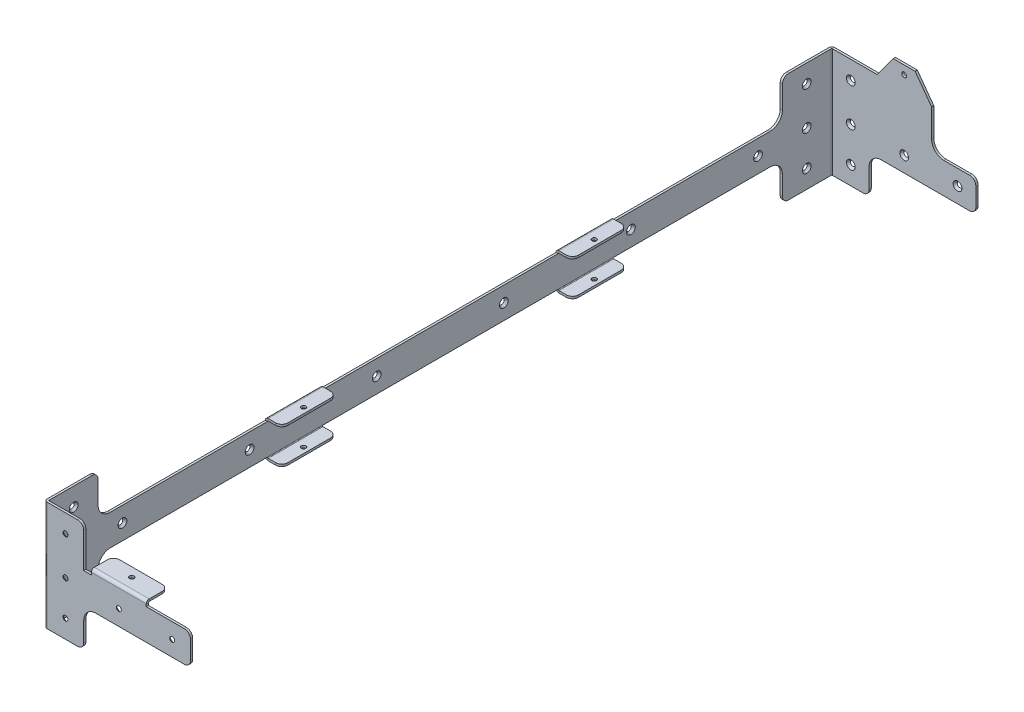
from build123d import *

# Parameters (mm, degrees)
SKETCH1_W                                         = 815.975
SKETCH1_H                                         = 33.147
BASE_FLANGE1_DEPTH                                = 2.286
EDGE_FLANGE2_STRIP_W                              = 10.8712
EDGE_FLANGE2_STRIP_H                              = 2.286
EDGE_FLANGE2_STRIP_CUT_DEPTH                      = 815.975
EDGE_FLANGE2_DEPTH                                = 815.975
EDGE_FLANGE3_STRIP_W                              = 10.8712
EDGE_FLANGE3_STRIP_H                              = 2.286
EDGE_FLANGE3_STRIP_CUT_DEPTH                      = 815.975
EDGE_FLANGE3_DEPTH                                = 815.975
EDGE_FLANGE4_STRIP_W                              = 10.8712
EDGE_FLANGE4_STRIP_H                              = 2.286
EDGE_FLANGE4_STRIP_CUT_DEPTH                      = 32.1818
EDGE_FLANGE4_DEPTH                                = 32.1818
EDGE_FLANGE6_STRIP_W                              = 10.8712
EDGE_FLANGE6_STRIP_H                              = 2.286
EDGE_FLANGE6_STRIP_CUT_DEPTH                      = 32.1818
EDGE_FLANGE6_DEPTH                                = 32.1818
CUT_EXTRUDE1_START                                = -3.0226
SKETCH18_W                                        = 17.145
SKETCH18_H                                        = 227.9015
SKETCH18_H_2                                      = 245.872
CUT_EXTRUDE1_DEPTH                                = 3.0226
CUT_EXTRUDE2_START                                = -3.0226
SKETCH23_W                                        = 17.145
SKETCH23_H                                        = 227.9015
SKETCH23_H_2                                      = 245.872
CUT_EXTRUDE2_DEPTH                                = 3.0226
EDGE_FLANGE7_DEPTH                                = 149.3774
CUT_EXTRUDE4_START                                = -5.4991
SKETCH46_W                                        = 46.1137
SKETCH46_H                                        = 23.01875
CUT_EXTRUDE4_DEPTH                                = 5.4991
SKETCH24_R                                        = 2.38125
CUT_EXTRUDE3_DEPTH                                = 834.161324794
FILLET1_R                                         = 6.35
BOSS_EXTRUDE1_DEPTH                               = 2.286
F_10_CLEARANCE_HOLE1_D                            = 4.9784
CSK_FOR_8_FLAT_HEAD_SOCKET_CAP_SCREW2_A_COUNT     = 2
CSK_FOR_8_FLAT_HEAD_SOCKET_CAP_SCREW2_A_PITCH     = 55.6387
CSK_FOR_8_FLAT_HEAD_SOCKET_CAP_SCRE_2_COUNT       = 2
CSK_FOR_8_FLAT_HEAD_SOCKET_CAP_SCRE_2_PITCH       = 111.2774
CSK_FOR_8_FLAT_HEAD_SOCKET_CAP_SCREW1_D           = 4.3053
CSK_FOR_8_FLAT_HEAD_SOCKET_CAP_SCREW1_DEPTH       = 76.2
CSK_FOR_8_FLAT_HEAD_SOCKET_CAP_SCREW1_CSINK_D     = 9.1186
CSK_FOR_8_FLAT_HEAD_SOCKET_CAP_SCREW1_CSINK_ANGLE = 82
CSK_FOR_8_FLAT_HEAD_SOCKET_CAP_SCREW1_TIP         = 1.293442612
BOSS_EXTRUDE2_DEPTH                               = 42.7101
BOSS_EXTRUDE3_START                               = 39.4081
BOSS_EXTRUDE3_DEPTH                               = 39.4081
CSK_FOR_8_FLAT_HEAD_SOCKET_CAP_SCREW3_A_COUNT     = 2
CSK_FOR_8_FLAT_HEAD_SOCKET_CAP_SCREW3_A_PITCH     = 76.2
CSK_FOR_8_FLAT_HEAD_SOCKET_CAP_SCREW4_A_COUNT     = 2
CSK_FOR_8_FLAT_HEAD_SOCKET_CAP_SCREW4_A_PITCH     = 39.751
CSK_FOR_8_FLAT_HEAD_SOCKET_CAP_SCRE_3_COUNT       = 2
CSK_FOR_8_FLAT_HEAD_SOCKET_CAP_SCRE_3_PITCH       = 76.2
BOSS_EXTRUDE6_START                               = -2.286
BOSS_EXTRUDE6_DEPTH                               = 2.286
FILLET2_R                                         = 6.35
FILLET3_R                                         = 12.7


# Read off the part's stored shape, not the designer's step: Boss-Extrude6
# Sheet-metal steps are written as plain solids
with BuildPart() as part:
    # Sketch1 → Base-Flange1 (new body)
    with BuildSketch(Plane(origin=(0, 0, 0), x_dir=(0, 0, -1), z_dir=(1, 0, 0))):
        with Locations((407.9875, 16.5735)):
            Rectangle(SKETCH1_W, SKETCH1_H)
    extrude(amount=-BASE_FLANGE1_DEPTH)

    # Edge-Flange2 strip (across the edge) → Edge-Flange2 strip cut (cut)
    with BuildSketch(Plane(origin=(0, 33.401, -815.975), x_dir=(0, -1, 0), z_dir=(0, 0, 1))):
        with Locations((-4.699, -1.143)):
            Rectangle(EDGE_FLANGE2_STRIP_W, EDGE_FLANGE2_STRIP_H)
    extrude(amount=EDGE_FLANGE2_STRIP_CUT_DEPTH, mode=Mode.SUBTRACT)

    # Edge-Flange2 section (across the edge) → Edge-Flange2 (add)
    with BuildSketch(Plane(origin=(0, 33.401, -815.975), x_dir=(0, -1, 0), z_dir=(0, 0, 1))):
        with BuildLine():
            Line((-2.286, 0.7366), (-2.286, 14.859))
            Line((-2.286, 14.859), (0, 14.859))
            Line((0, 14.859), (0, 0.7366))
            ThreePointArc((0, 0.7366), (0.215745145, 0.215745145), (0.7366, 0))
            Line((0.7366, 0), (0.7366, -2.286))
            ThreePointArc((0.7366, -2.286), (-1.400700957, -1.400700957), (-2.286, 0.7366))
        make_face()
    extrude(amount=EDGE_FLANGE2_DEPTH)

    # Edge-Flange3 strip (across the edge) → Edge-Flange3 strip cut (cut)
    with BuildSketch(Plane(origin=(0, -0.254, 0), x_dir=(0, 1, 0), z_dir=(0, 0, -1))):
        with Locations((-4.699, -1.143)):
            Rectangle(EDGE_FLANGE3_STRIP_W, EDGE_FLANGE3_STRIP_H)
    extrude(amount=EDGE_FLANGE3_STRIP_CUT_DEPTH, mode=Mode.SUBTRACT)

    # Edge-Flange3 section (across the edge) → Edge-Flange3 (add)
    with BuildSketch(Plane(origin=(0, -0.254, 0), x_dir=(0, 1, 0), z_dir=(0, 0, -1))):
        with BuildLine():
            Line((-2.286, 0.7366), (-2.286, 14.859))
            Line((-2.286, 14.859), (0, 14.859))
            Line((0, 14.859), (0, 0.7366))
            ThreePointArc((0, 0.7366), (0.215745145, 0.215745145), (0.7366, 0))
            Line((0.7366, 0), (0.7366, -2.286))
            ThreePointArc((0.7366, -2.286), (-1.400700957, -1.400700957), (-2.286, 0.7366))
        make_face()
    extrude(amount=EDGE_FLANGE3_DEPTH)

    # Edge-Flange4 strip (across the edge) → Edge-Flange4 strip cut (cut)
    with BuildSketch(Plane(origin=(0, 32.6644, 0.254), x_dir=(0, 0, -1), z_dir=(0, -1, 0))):
        with Locations((-4.699, -1.143)):
            Rectangle(EDGE_FLANGE4_STRIP_W, EDGE_FLANGE4_STRIP_H)
    extrude(amount=EDGE_FLANGE4_STRIP_CUT_DEPTH, mode=Mode.SUBTRACT)

    # Edge-Flange4 section (across the edge) → Edge-Flange4 (add)
    with BuildSketch(Plane(origin=(0, 32.6644, 0.254), x_dir=(0, 0, -1), z_dir=(0, -1, 0))):
        with BuildLine():
            Line((-2.286, 0.7366), (-2.286, 150.114))
            Line((-2.286, 150.114), (0, 150.114))
            Line((0, 150.114), (0, 0.7366))
            ThreePointArc((0, 0.7366), (0.215745145, 0.215745145), (0.7366, 0))
            Line((0.7366, 0), (0.7366, -2.286))
            ThreePointArc((0.7366, -2.286), (-1.400700957, -1.400700957), (-2.286, 0.7366))
        make_face()
    extrude(amount=EDGE_FLANGE4_DEPTH)

    # Edge-Flange6 strip (across the edge) → Edge-Flange6 strip cut (cut)
    with BuildSketch(Plane(origin=(0, 0.4826, -816.229), x_dir=(0, 0, 1), z_dir=(0, 1, 0))):
        with Locations((-4.699, -1.143)):
            Rectangle(EDGE_FLANGE6_STRIP_W, EDGE_FLANGE6_STRIP_H)
    extrude(amount=EDGE_FLANGE6_STRIP_CUT_DEPTH, mode=Mode.SUBTRACT)

    # Edge-Flange6 section (across the edge) → Edge-Flange6 (add)
    with BuildSketch(Plane(origin=(0, 0.4826, -816.229), x_dir=(0, 0, 1), z_dir=(0, 1, 0))):
        with BuildLine():
            Line((-2.286, 0.7366), (-2.286, 150.114))
            Line((-2.286, 150.114), (0, 150.114))
            Line((0, 150.114), (0, 0.7366))
            ThreePointArc((0, 0.7366), (0.215745145, 0.215745145), (0.7366, 0))
            Line((0.7366, 0), (0.7366, -2.286))
            ThreePointArc((0.7366, -2.286), (-1.400700957, -1.400700957), (-2.286, 0.7366))
        make_face()
    extrude(amount=EDGE_FLANGE6_DEPTH)

    # Sketch18 → Cut-Extrude1 (cut)
    with BuildSketch(Plane(origin=(0, 35.687, 0), x_dir=(1, 0, 0), z_dir=(0, 1, 0)).offset(CUT_EXTRUDE1_START)):
        with Locations((6.2865, 702.02425)):
            Rectangle(SKETCH18_W, SKETCH18_H)
        with Locations((6.2865, 407.9875)):
            Rectangle(SKETCH18_W, SKETCH18_H_2)
        with Locations((6.2865, 113.95075)):
            Rectangle(SKETCH18_W, SKETCH18_H)
    extrude(amount=CUT_EXTRUDE1_DEPTH, mode=Mode.SUBTRACT)

    # Sketch23 → Cut-Extrude2 (cut)
    with BuildSketch(Plane.XZ.offset(2.54).offset(CUT_EXTRUDE2_START)):
        with Locations((6.2865, -113.95075)):
            Rectangle(SKETCH23_W, SKETCH23_H)
        with Locations((6.2865, -702.02425)):
            Rectangle(SKETCH23_W, SKETCH23_H)
        with Locations((6.2865, -407.9875)):
            Rectangle(SKETCH23_W, SKETCH23_H_2)
    extrude(amount=CUT_EXTRUDE2_DEPTH, mode=Mode.SUBTRACT)

    # Edge-Flange7 section (across the edge) → Edge-Flange7 (add)
    with BuildSketch(Plane(origin=(0.7366, 35.8775, 0.254), x_dir=(0, -1, 0), z_dir=(1, 0, 0))):
        with BuildLine():
            Line((-2.286, 0.7366), (-2.286, 20.73275))
            Line((-2.286, 20.73275), (0, 20.73275))
            Line((0, 20.73275), (0, 0.7366))
            ThreePointArc((0, 0.7366), (0.215745145, 0.215745145), (0.7366, 0))
            Line((0.7366, 0), (3.2131, 0))
            Line((3.2131, 0), (3.2131, -2.286))
            Line((3.2131, -2.286), (0.7366, -2.286))
            ThreePointArc((0.7366, -2.286), (-1.400700957, -1.400700957), (-2.286, 0.7366))
        make_face()
    extrude(amount=EDGE_FLANGE7_DEPTH)

    # Sketch46 → Cut-Extrude4 (cut)
    with BuildSketch(Plane(origin=(0, 38.1635, 0), x_dir=(1, 0, 0), z_dir=(0, 1, 0)).offset(CUT_EXTRUDE4_START)):
        with Locations((127.05715, 8.969375)):
            Rectangle(SKETCH46_W, SKETCH46_H)
        with Locations((23.79345, 8.969375)):
            Rectangle(SKETCH46_W, SKETCH46_H)
    extrude(amount=CUT_EXTRUDE4_DEPTH, mode=Mode.SUBTRACT)

    # Sketch24 → Cut-Extrude3 (cut, through all)
    with BuildSketch(Plane(origin=(0, 38.1635, 0), x_dir=(1, 0, 0), z_dir=(0, 1, 0))):
        with Locations((9.032875, 256.4765)):
            Circle(SKETCH24_R)
        with Locations((9.032875, 559.4985)):
            Circle(SKETCH24_R)
        with Locations(Location((75.4253, 10.95375, 0), (0, 0, 270))):
            Circle(SKETCH24_R)
    extrude(amount=-CUT_EXTRUDE3_DEPTH, mode=Mode.SUBTRACT)

    # Fillet1
    fillet1_edges = [part.edges().sort_by_distance(p)[0] for p in [
        (150.114, 0.4826, 1.397),
        (150.114, 0.4826, -817.372),
        (150.114, 32.6644, -817.372),
        (14.859, 34.544, -588.0735),
        (14.859, 34.544, -530.9235),
        (14.859, 34.544, -285.0515),
        (14.859, 34.544, -227.9015),
        (14.859, -1.397, -588.0735),
        (14.859, -1.397, -285.0515),
        (14.859, -1.397, -530.9235),
        (14.859, -1.397, -227.9015),
        (104.0003, 37.0205, -20.47875),
        (150.114, 32.6644, 1.397),
        (46.8503, 37.0205, -20.47875),
    ]]
    fillet(fillet1_edges, radius=FILLET1_R)

    # Sketch55 → Boss-Extrude1 (add)
    with BuildSketch(Plane(origin=(0, 0, -818.515), x_dir=(-1, 0, 0), z_dir=(0, 0, -1))):
        Polygon((-104.0003, 32.6644), (-46.8503, 32.6644), (-46.8503, 74.6379), (-63.9953, 98.1329), (-86.8553, 98.1329), (-104.0003, 74.6379), align=None)
    extrude(amount=-BOSS_EXTRUDE1_DEPTH)

    # #10 Clearance Hole1 (through all)
    with Locations(Plane(origin=(0, 0, -818.515), x_dir=(-1, 0, 0), z_dir=(0, 0, -1))):
        with Locations((-75.4253, 89.2429)):
            Hole(F_10_CLEARANCE_HOLE1_D / 2)

    # Sketch60 → CSK for #8 Flat Head Socket Cap Screw2 (revolve, cut)
    with BuildSketch(Plane(origin=(131.064, 16.5735, 0.254), x_dir=(0, 1, 0), z_dir=(1, 0, 0))):
        Polygon((0, 0), (0, 77.493442612), (2.15265, 76.2), (2.15265, 2.768534127), (4.5593, 0), align=None)
    csk_for_8_flat_head_socket_cap_screw2 = revolve(axis=Axis((131.064, 16.5735, -6.096), (0, 0, 1)), mode=Mode.SUBTRACT)

    # CSK for #8 Flat Head Socket Cap Screw2 a: CSK for #8 Flat Head Socket Cap Screw2 ×2
    with Locations(*[(-i * CSK_FOR_8_FLAT_HEAD_SOCKET_CAP_SCREW2_A_PITCH, 0, 0) for i in range(1, CSK_FOR_8_FLAT_HEAD_SOCKET_CAP_SCREW2_A_COUNT)]):
        add(csk_for_8_flat_head_socket_cap_screw2, mode=Mode.SUBTRACT)

    # CSK for _8 Flat Head Socket Cap Scre 2: CSK for #8 Flat Head Socket Cap Screw2 ×2
    with Locations(*[(-i * CSK_FOR_8_FLAT_HEAD_SOCKET_CAP_SCRE_2_PITCH, 0, 0) for i in range(1, CSK_FOR_8_FLAT_HEAD_SOCKET_CAP_SCRE_2_COUNT)]):
        add(csk_for_8_flat_head_socket_cap_screw2, mode=Mode.SUBTRACT)

    # CSK for #8 Flat Head Socket Cap Screw1
    with Locations(Plane(origin=(0, 0, 0), x_dir=(0, 0, -1), z_dir=(1, 0, 0))):
        with Locations((76.6826, 16.5735), (209.20456, 16.5735), (341.72652, 16.5735), (474.24848, 16.5735), (606.77044, 16.5735), (739.2924, 16.5735)):
            CounterSinkHole(CSK_FOR_8_FLAT_HEAD_SOCKET_CAP_SCREW1_D / 2, CSK_FOR_8_FLAT_HEAD_SOCKET_CAP_SCREW1_CSINK_D / 2, depth=CSK_FOR_8_FLAT_HEAD_SOCKET_CAP_SCREW1_DEPTH, counter_sink_angle=CSK_FOR_8_FLAT_HEAD_SOCKET_CAP_SCREW1_CSINK_ANGLE)
            with Locations((0, 0, -(CSK_FOR_8_FLAT_HEAD_SOCKET_CAP_SCREW1_DEPTH + CSK_FOR_8_FLAT_HEAD_SOCKET_CAP_SCREW1_TIP / 2))):  # 118° drill point
                Cone(0, CSK_FOR_8_FLAT_HEAD_SOCKET_CAP_SCREW1_D / 2, CSK_FOR_8_FLAT_HEAD_SOCKET_CAP_SCREW1_TIP, mode=Mode.SUBTRACT)

    # Mirror1: CSK for #8 Flat Head Socket Cap Screw2 across plane
    add(csk_for_8_flat_head_socket_cap_screw2.mirror(Plane(origin=(0, 0, -407.9875), x_dir=(1, 0, 0), z_dir=(0, 0, -1))), mode=Mode.SUBTRACT)

    # Mirror1 copy 1 sketch → Mirror1 copy 1 (revolve, cut)
    with BuildSketch(Plane(origin=(75.4253, 16.5735, -816.229), x_dir=(0, 1, 0), z_dir=(1, 0, 0))):
        Polygon((0, 0), (0, -77.493442612), (2.15265, -76.2), (2.15265, -2.768534127), (4.5593, 0), align=None)
    revolve(axis=Axis((75.4253, 16.5735, -809.879), (0, 0, 1)), mode=Mode.SUBTRACT)

    # Mirror1 copy 2 sketch → Mirror1 copy 2 (revolve, cut)
    with BuildSketch(Plane(origin=(19.7866, 16.5735, -816.229), x_dir=(0, 1, 0), z_dir=(1, 0, 0))):
        Polygon((0, 0), (0, -77.493442612), (2.15265, -76.2), (2.15265, -2.768534127), (4.5593, 0), align=None)
    revolve(axis=Axis((19.7866, 16.5735, -809.879), (0, 0, 1)), mode=Mode.SUBTRACT)

    # Sketch63 → Boss-Extrude2 (add)
    with BuildSketch(Plane(origin=(0, 32.6644, 0), x_dir=(1, 0, 0), z_dir=(0, 1, 0))):
        with BuildLine():
            Line((38.8366, 818.515), (38.8366, 816.229))
            Line((38.8366, 816.229), (0.7366, 816.229))
            ThreePointArc((0.7366, 816.229), (0.215745145, 816.013254855), (0, 815.4924))
            Line((0, 815.4924), (0, 764.6924))
            Line((0, 764.6924), (-2.286, 764.6924))
            Line((-2.286, 764.6924), (-2.286, 815.4924))
            ThreePointArc((-2.286, 815.4924), (-1.400700957, 817.629700957), (0.7366, 818.515))
            Line((0.7366, 818.515), (38.8366, 818.515))
        make_face()
    boss_extrude2 = extrude(amount=BOSS_EXTRUDE2_DEPTH)

    # Sketch64 → Boss-Extrude3 (add)
    with BuildSketch(Plane.XZ.offset(-0.4826).offset(BOSS_EXTRUDE3_START)):
        with BuildLine():
            Line((38.8366, -818.515), (38.8366, -816.229))
            Line((38.8366, -816.229), (0.7366, -816.229))
            ThreePointArc((0.7366, -816.229), (0.215745145, -816.013254855), (0, -815.4924))
            Line((0, -815.4924), (0, -764.6924))
            Line((0, -764.6924), (-2.286, -764.6924))
            Line((-2.286, -764.6924), (-2.286, -815.4924))
            ThreePointArc((-2.286, -815.4924), (-1.400700957, -817.629700957), (0.7366, -818.515))
            Line((0.7366, -818.515), (38.8366, -818.515))
        make_face()
    boss_extrude3 = extrude(amount=-BOSS_EXTRUDE3_DEPTH)

    # Sketch66 → CSK for #8 Flat Head Socket Cap Screw3 (revolve, cut)
    with BuildSketch(Plane(origin=(19.7866, 56.3245, -816.229), x_dir=(0, -1, 0), z_dir=(1, 0, 0))):
        Polygon((0, 0), (0, 77.493442612), (2.15265, 76.2), (2.15265, 2.768534127), (4.5593, 0), align=None)
    csk_for_8_flat_head_socket_cap_screw3 = revolve(axis=Axis((19.7866, 56.3245, -809.879), (0, 0, -1)), mode=Mode.SUBTRACT)

    # CSK for #8 Flat Head Socket Cap Screw3 a: CSK for #8 Flat Head Socket Cap Screw3 ×2
    with Locations(*[(0, -i * CSK_FOR_8_FLAT_HEAD_SOCKET_CAP_SCREW3_A_PITCH, 0) for i in range(1, CSK_FOR_8_FLAT_HEAD_SOCKET_CAP_SCREW3_A_COUNT)]):
        add(csk_for_8_flat_head_socket_cap_screw3, mode=Mode.SUBTRACT)

    # Sketch68 → CSK for #8 Flat Head Socket Cap Screw4 (revolve, cut)
    with BuildSketch(Plane(origin=(0, 56.3245, -790.0924), x_dir=(0, 0, -1), z_dir=(0, 1, 0))):
        Polygon((0, 0), (0, 77.493442612), (2.15265, 76.2), (2.15265, 2.768534127), (4.5593, 0), align=None)
    csk_for_8_flat_head_socket_cap_screw4 = revolve(axis=Axis((6.35, 56.3245, -790.0924), (-1, 0, 0)), mode=Mode.SUBTRACT)

    # CSK for #8 Flat Head Socket Cap Screw4 a: CSK for #8 Flat Head Socket Cap Screw4 ×2
    with Locations(*[(0, -i * CSK_FOR_8_FLAT_HEAD_SOCKET_CAP_SCREW4_A_PITCH, 0) for i in range(1, CSK_FOR_8_FLAT_HEAD_SOCKET_CAP_SCREW4_A_COUNT)]):
        add(csk_for_8_flat_head_socket_cap_screw4, mode=Mode.SUBTRACT)

    # CSK for _8 Flat Head Socket Cap Scre 3: CSK for #8 Flat Head Socket Cap Screw4 ×2
    with Locations(*[(0, -i * CSK_FOR_8_FLAT_HEAD_SOCKET_CAP_SCRE_3_PITCH, 0) for i in range(1, CSK_FOR_8_FLAT_HEAD_SOCKET_CAP_SCRE_3_COUNT)]):
        add(csk_for_8_flat_head_socket_cap_screw4, mode=Mode.SUBTRACT)

    # Mirror2: Boss-Extrude2, Boss-Extrude3, CSK for #8 Flat Head Socket Cap Screw3, CSK for #8 Flat Head Socket Cap Screw4 across plane
    add(boss_extrude2.mirror(Plane(origin=(0, 0, -407.9875), x_dir=(1, 0, 0), z_dir=(0, 0, -1))))
    add(boss_extrude3.mirror(Plane(origin=(0, 0, -407.9875), x_dir=(1, 0, 0), z_dir=(0, 0, -1))))
    add(csk_for_8_flat_head_socket_cap_screw3.mirror(Plane(origin=(0, 0, -407.9875), x_dir=(1, 0, 0), z_dir=(0, 0, -1))), mode=Mode.SUBTRACT)
    add(csk_for_8_flat_head_socket_cap_screw4.mirror(Plane(origin=(0, 0, -407.9875), x_dir=(1, 0, 0), z_dir=(0, 0, -1))), mode=Mode.SUBTRACT)

    # Mirror2 copy 1 sketch → Mirror2 copy 1 (revolve, cut)
    with BuildSketch(Plane(origin=(19.7866, -19.8755, 0.254), x_dir=(0, -1, 0), z_dir=(1, 0, 0))):
        Polygon((0, 0), (0, -77.493442612), (2.15265, -76.2), (2.15265, -2.768534127), (4.5593, 0), align=None)
    revolve(axis=Axis((19.7866, -19.8755, -6.096), (0, 0, -1)), mode=Mode.SUBTRACT)

    # Mirror2 copy 2 sketch → Mirror2 copy 2 (revolve, cut)
    with BuildSketch(Plane(origin=(0, 16.5735, -25.8826), x_dir=(0, 0, 1), z_dir=(0, 1, 0))):
        Polygon((0, 0), (0, -77.493442612), (2.15265, -76.2), (2.15265, -2.768534127), (4.5593, 0), align=None)
    revolve(axis=Axis((6.35, 16.5735, -25.8826), (1, 0, 0)), mode=Mode.SUBTRACT)

    # Mirror2 copy 3 sketch → Mirror2 copy 3 (revolve, cut)
    with BuildSketch(Plane(origin=(0, -19.8755, -25.8826), x_dir=(0, 0, 1), z_dir=(0, 1, 0))):
        Polygon((0, 0), (0, -77.493442612), (2.15265, -76.2), (2.15265, -2.768534127), (4.5593, 0), align=None)
    revolve(axis=Axis((6.35, -19.8755, -25.8826), (1, 0, 0)), mode=Mode.SUBTRACT)

    # Boss-Extrude6 outline → Boss-Extrude6 (add)
    with BuildSketch(Plane(origin=(0, 0, -818.515), x_dir=(-1, 0, 0), z_dir=(0, 0, -1)).offset(BOSS_EXTRUDE6_START)):
        Polygon((-38.8366, 32.6644), (-38.8366, 75.3745), (-47.387818919, 75.3745), (-46.8503, 74.6379), (-46.8503, 32.6644), align=None)
    extrude(amount=BOSS_EXTRUDE6_DEPTH)

    # Fillet2
    fillet2_edges = [part.edges().sort_by_distance(p)[0] for p in [
        (-1.143, 75.3745, -764.6924),
        (38.8366, -38.9255, -817.372),
        (-1.143, -38.9255, -764.6924),
        (38.8366, 75.3745, 1.397),
        (-1.143, 75.3745, -51.2826),
        (-1.143, -38.9255, -51.2826),
        (38.8366, -38.9255, 1.397),
    ]]
    fillet(fillet2_edges, radius=FILLET2_R)

    # Fillet3
    fillet3_edges = [part.edges().sort_by_distance(p)[0] for p in [
        (104.0003, 32.6644, -817.372),
        (-1.143, 32.6644, -764.6924),
        (38.8366, 0.4826, -817.372),
        (-1.143, 0.4826, -764.6924),
        (-1.143, 32.6644, -51.2826),
        (-1.143, 0.4826, -51.2826),
        (38.8366, 0.4826, 1.397),
    ]]
    fillet(fillet3_edges, radius=FILLET3_R)


solid = part.part
